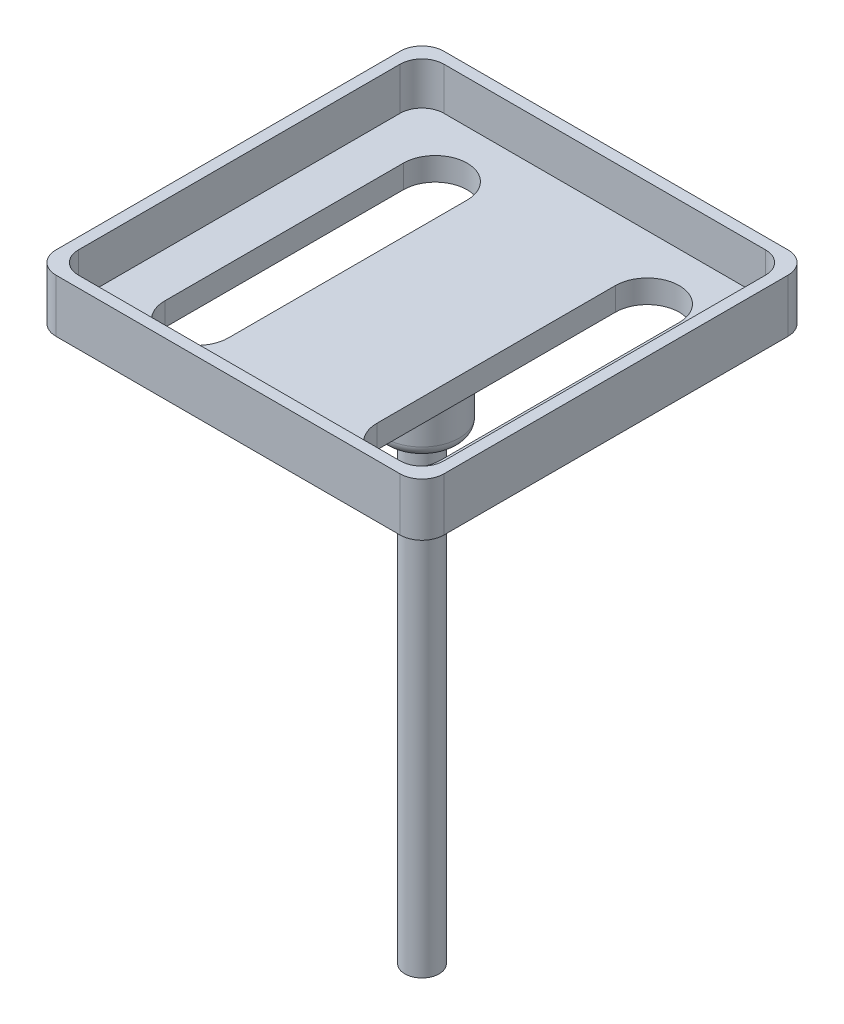
from build123d import *

# Parameters (mm, degrees)
SKETCH1_R           = 1.9939
BOSS_EXTRUDE1_DEPTH = 62.8904
SKETCH2_W           = 42.418
SKETCH2_H           = 42.418
SKETCH2_R           = 1.9939
BOSS_EXTRUDE2_DEPTH = 2.6797
SKETCH2_3_W         = 45.0215
SKETCH2_3_H         = 45.0215
SKETCH2_3_W_2       = 42.418
SKETCH2_3_H_2       = 42.418
BOSS_EXTRUDE3_DEPTH = 7.62
FILLET1_R           = 2.54
SKETCH3_R           = 4.318
BOSS_EXTRUDE4_DEPTH = 9.144
FILLET2_R           = 2.54
FILLET3_R           = 1.27
CHAMFER1_SIZE       = 2.54
CHAMFER1_SIZE_2     = 1.466469684


with BuildPart() as part:
    # Sketch1 → Boss-Extrude1 (new body)
    with BuildSketch(Plane(origin=(0, 0, 0), x_dir=(1, 0, 0), z_dir=(0, 1, 0))):
        with Locations(Location((0, 0, 0), (0, 0, 270))):
            Circle(SKETCH1_R)
    extrude(amount=BOSS_EXTRUDE1_DEPTH)



with BuildPart() as body_2:
    # Sketch2 → Boss-Extrude2 (new body)
    # profile 1 of 2: a face of its own
    with BuildSketch(Plane(origin=(0, 62.8904, 0), x_dir=(1, 0, 0), z_dir=(0, 1, 0))):
        Rectangle(SKETCH2_W, SKETCH2_H)
        with Locations(Location((0, 0, 0), (0, 0, 270))):
            Circle(SKETCH2_R, mode=Mode.SUBTRACT)
        with BuildLine():
            ThreePointArc((-16.0147, -13.843), (-12.3063, -17.5514), (-8.5979, -13.843))
            Line((-8.5979, -13.843), (-8.5979, 13.843))
            ThreePointArc((-8.5979, 13.843), (-12.3063, 17.5514), (-16.0147, 13.843))
            Line((-16.0147, 13.843), (-16.0147, -13.843))
        make_face(mode=Mode.SUBTRACT)
        with BuildLine():
            Line((16.0147, 13.843), (16.0147, -13.843))
            ThreePointArc((16.0147, -13.843), (12.3063, -17.5514), (8.5979, -13.843))
            Line((8.5979, -13.843), (8.5979, 13.843))
            ThreePointArc((8.5979, 13.843), (12.3063, 17.5514), (16.0147, 13.843))
        make_face(mode=Mode.SUBTRACT)
    # profile 2 of 2: a face of its own
    with BuildSketch(Plane(origin=(0, 62.8904, 0), x_dir=(1, 0, 0), z_dir=(0, 1, 0))):
        with Locations(Location((0, 0, 0), (0, 0, 270))):
            Circle(SKETCH2_R)
    extrude(amount=BOSS_EXTRUDE2_DEPTH)


with BuildPart() as part_1:
    add(part.part)

    add(body_2.part)  # Boss-Extrude3 merges body 2
    # Sketch2<3> → Boss-Extrude3 (add)
    with BuildSketch(Plane(origin=(0, 62.8904, 0), x_dir=(1, 0, 0), z_dir=(0, 1, 0))):
        Rectangle(SKETCH2_3_W, SKETCH2_3_H)
        Rectangle(SKETCH2_3_W_2, SKETCH2_3_H_2, mode=Mode.SUBTRACT)
    extrude(amount=BOSS_EXTRUDE3_DEPTH)

    # Fillet1
    fillet1_edges = [part_1.edges().sort_by_distance(p)[0] for p in [
        (21.209, 68.04025, 21.209),
        (-21.209, 68.04025, 21.209),
        (-21.209, 68.04025, -21.209),
        (-22.51075, 66.7004, 22.51075),
        (22.51075, 66.7004, 22.51075),
        (22.51075, 66.7004, -22.51075),
        (-22.51075, 66.7004, -22.51075),
        (21.209, 68.04025, -21.209),
    ]]
    fillet(fillet1_edges, radius=FILLET1_R)

    # Sketch3 → Boss-Extrude4 (add)
    with BuildSketch(Plane.XZ.offset(-62.8904)):
        with Locations(Location((0, 0, 0), (0, 0, 90))):
            Circle(SKETCH3_R)
    extrude(amount=BOSS_EXTRUDE4_DEPTH)

    # Fillet2
    fillet2_edges = [part_1.edges().sort_by_distance(p)[0] for p in [
        (0, 62.8904, -4.318),
    ]]
    fillet(fillet2_edges, radius=FILLET2_R)

    # Fillet3
    fillet3_edges = [part_1.edges().sort_by_distance(p)[0] for p in [
        (0, 53.7464, -4.318),
    ]]
    fillet(fillet3_edges, radius=FILLET3_R)

    # Chamfer1
    # the kernel refuses this chamfer: 2.54, 1.466469684 mm, written as the material it takes off along each edge
    with BuildSketch(Plane(origin=(-19.97075, 62.8904, 22.51075), x_dir=(0, 0, -1), z_dir=(1, 0, 0)), Plane(origin=(-22.51075, 62.8904, -19.97075), x_dir=(1, 0, 0), z_dir=(0, 0, 1)), Plane(origin=(19.97075, 62.8904, -22.51075), x_dir=(0, 0, 1), z_dir=(-1, 0, 0)), Plane(origin=(22.51075, 62.8904, 19.97075), x_dir=(-1, 0, 0), z_dir=(0, 0, -1))) as chamfer1_piece_1:
        Polygon((CHAMFER1_SIZE, 0), (0, CHAMFER1_SIZE_2), (0, 0), align=None)
    extrude(amount=39.9415, mode=Mode.SUBTRACT)
    with BuildSketch(Plane(origin=(-19.97075, 62.8904, -19.97075), x_dir=(0, 0, -1), z_dir=(1, 0, 0))) as chamfer1_piece_2:
        Polygon((2.54 - CHAMFER1_SIZE, 0), (2.54, CHAMFER1_SIZE_2), (2.54, 0), align=None)
    revolve(axis=Axis((-19.97075, 62.8904, -19.97075), (0, 1, 0)), revolution_arc=90, mode=Mode.SUBTRACT)
    with BuildSketch(Plane(origin=(19.97075, 62.8904, 19.97075), x_dir=(0, 0, 1), z_dir=(-1, 0, 0))) as chamfer1_piece_3:
        Polygon((2.54 - CHAMFER1_SIZE, 0), (2.54, CHAMFER1_SIZE_2), (2.54, 0), align=None)
    revolve(axis=Axis((19.97075, 62.8904, 19.97075), (0, 1, 0)), revolution_arc=90, mode=Mode.SUBTRACT)
    with BuildSketch(Plane(origin=(19.97075, 62.8904, -19.97075), x_dir=(1, 0, 0), z_dir=(0, 0, 1))) as chamfer1_piece_4:
        Polygon((2.54 - CHAMFER1_SIZE, 0), (2.54, CHAMFER1_SIZE_2), (2.54, 0), align=None)
    revolve(axis=Axis((19.97075, 62.8904, -19.97075), (0, 1, 0)), revolution_arc=90, mode=Mode.SUBTRACT)
    with BuildSketch(Plane(origin=(-19.97075, 62.8904, 19.97075), x_dir=(0, 0, 1), z_dir=(1, 0, 0))) as chamfer1_piece_5:
        Polygon((2.54 - CHAMFER1_SIZE, 0), (2.54, -CHAMFER1_SIZE_2), (2.54, 0), align=None)
    revolve(axis=Axis((-19.97075, 62.8904, 19.97075), (0, -1, 0)), revolution_arc=90, mode=Mode.SUBTRACT)


solid = part_1.part
